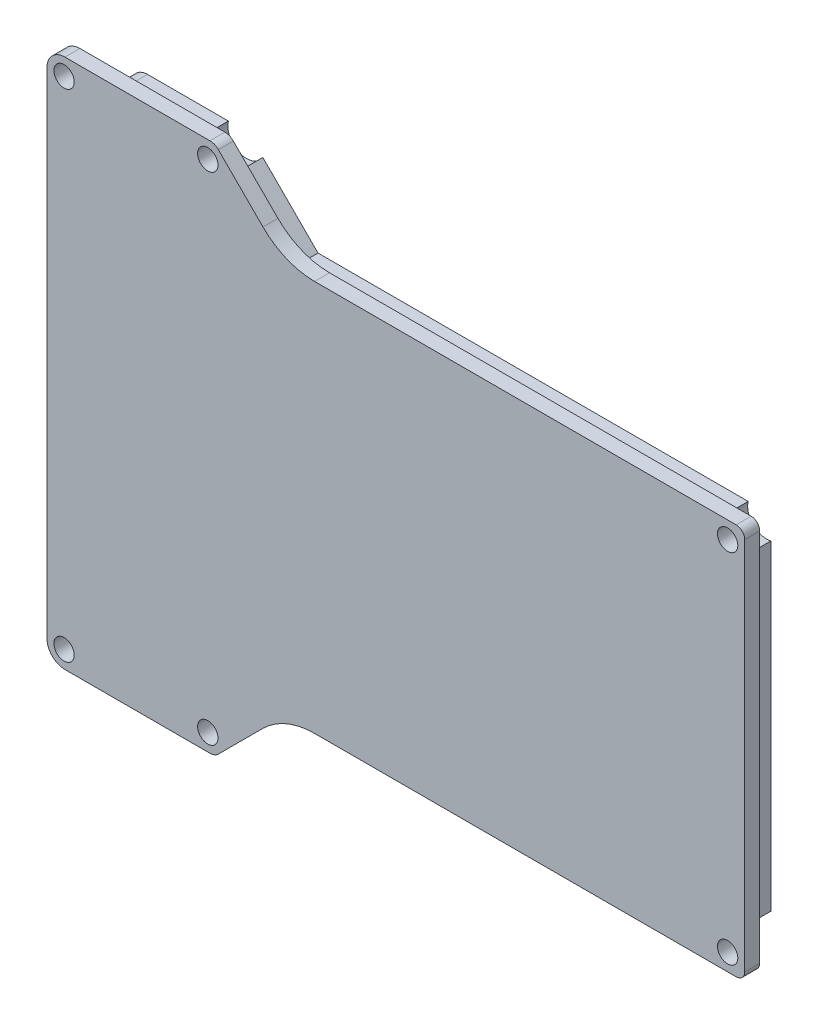
from build123d import *

# Parameters (mm, degrees)
BOSS_EXTRUDE1_DEPTH = 2.5
BOSS_EXTRUDE2_DEPTH = 4
SKETCH2_R           = 1.7
CUT_EXTRUDE1_DEPTH  = 10


with BuildPart() as part:
    # Sketch1 → Boss-Extrude1 (new body)
    with BuildSketch(Plane.XY):
        with BuildLine():
            Line((-4.3, -102.073599188), (19.918814142, -102.073599188))
            ThreePointArc((19.918814142, -102.073599188), (20.684181007, -101.921358253), (21.333027704, -101.48781275))
            Line((21.333027704, -101.48781275), (28.78511557, -94.035724885))
            ThreePointArc((28.78511557, -94.035724885), (32.741782732, -91.39196441), (37.408989873, -90.463599188))
            Line((37.408989873, -90.463599188), (107.834, -90.463599188))
            ThreePointArc((107.834, -90.463599188), (108.841627163, -90.046226351), (109.259, -89.038599188))
            Line((109.259, -89.038599188), (109.259, -26.495599188))
            ThreePointArc((109.259, -26.495599188), (108.841627163, -25.487972025), (107.834, -25.070599188))
            Line((107.834, -25.070599188), (37.403989873, -25.070599188))
            ThreePointArc((37.403989873, -25.070599188), (32.736782732, -24.142233967), (28.78011557, -21.498473491))
            Line((28.78011557, -21.498473491), (21.333027704, -14.051385626))
            ThreePointArc((21.333027704, -14.051385626), (20.684181007, -13.617840123), (19.918814142, -13.465599188))
            Line((19.918814142, -13.465599188), (-4.3, -13.465599188))
            ThreePointArc((-4.3, -13.465599188), (-6.421320344, -14.344278845), (-7.3, -16.465599188))
            Line((-7.3, -16.465599188), (-7.3, -99.073599188))
            ThreePointArc((-7.3, -99.073599188), (-6.421320344, -101.194919532), (-4.3, -102.073599188))
        make_face()
    extrude(amount=BOSS_EXTRUDE1_DEPTH)

    # Sketch1<3> → Boss-Extrude2 (add)
    with BuildSketch(Plane.XY):
        with BuildLine():
            ThreePointArc((22.260800834, -17.95466409), (18.358889111, -19.231591354), (16.502744799, -15.569599188))
            Line((16.502744799, -15.569599188), (3, -15.569599188))
            ThreePointArc((3, -15.569599188), (1.090811691, -16.360410879), (0.3, -18.269599188))
            Line((0.3, -18.269599188), (0.3, -97.269599188))
            ThreePointArc((0.3, -97.269599188), (1.090811691, -99.178787497), (3, -99.969599188))
            Line((3, -99.969599188), (16.502744799, -99.969599188))
            ThreePointArc((16.502744799, -99.969599188), (18.358889111, -96.307607022), (22.260800834, -97.584534286))
            Line((22.260800834, -97.584534286), (31.485735931, -88.359599188))
            Line((31.485735931, -88.359599188), (103.343254826, -88.359599188))
            ThreePointArc((103.343254826, -88.359599188), (104.176492319, -85.381091507), (107.155, -84.547854014))
            Line((107.155, -84.547854014), (107.155, -30.986344362))
            ThreePointArc((107.155, -30.986344362), (104.176492319, -30.153106869), (103.343254826, -27.174599188))
            Line((103.343254826, -27.174599188), (31.480735931, -27.174599188))
            Line((31.480735931, -27.174599188), (22.260800834, -17.95466409))
        make_face()
        with BuildLine():
            Line((22, -71.479599188), (90.115, -71.479599188))
            Line((90.115, -71.479599188), (105.155, -71.479599188))
            Line((105.155, -71.479599188), (105.155, -82.611758523))
            ThreePointArc((105.155, -82.611758523), (102.762278757, -83.966877945), (101.407159334, -86.359599188))
            Line((101.407159334, -86.359599188), (30.657308807, -86.359599188))
            Line((30.657308807, -86.359599188), (22.215613523, -94.801294472))
            ThreePointArc((22.215613523, -94.801294472), (17.593522246, -94.459847957), (14.566649307, -97.969599188))
            Line((14.566649307, -97.969599188), (3, -97.969599188))
            ThreePointArc((3, -97.969599188), (2.505025253, -97.764573935), (2.3, -97.269599188))
            Line((2.3, -97.269599188), (2.3, -71.479599188))
            Line((2.3, -71.479599188), (22, -71.479599188))
        make_face(mode=Mode.SUBTRACT)
        Polygon((2.3, -44.374599188), (22, -44.374599188), (90.115, -44.374599188), (105.155, -44.374599188), (105.155, -69.479599188), (90.115, -69.479599188), (22, -69.479599188), (2.3, -69.479599188), align=None, mode=Mode.SUBTRACT)
        with BuildLine():
            Line((105.155, -42.374599188), (90.115, -42.374599188))
            Line((90.115, -42.374599188), (22, -42.374599188))
            Line((22, -42.374599188), (2.3, -42.374599188))
            Line((2.3, -42.374599188), (2.3, -18.269599188))
            ThreePointArc((2.3, -18.269599188), (2.505025253, -17.774624441), (3, -17.569599188))
            Line((3, -17.569599188), (14.566649307, -17.569599188))
            ThreePointArc((14.566649307, -17.569599188), (17.593522246, -21.079350419), (22.215613523, -20.737903904))
            Line((22.215613523, -20.737903904), (30.652308807, -29.174599188))
            Line((30.652308807, -29.174599188), (101.407159334, -29.174599188))
            ThreePointArc((101.407159334, -29.174599188), (102.762278757, -31.567320432), (105.155, -32.922439854))
            Line((105.155, -32.922439854), (105.155, -42.374599188))
        make_face(mode=Mode.SUBTRACT)
    extrude(amount=-BOSS_EXTRUDE2_DEPTH)

    # Sketch2 → Cut-Extrude1 (cut)
    with BuildSketch(Plane.XY.offset(2.5)):
        with Locations((106.406, -87.610599188)):
            Circle(SKETCH2_R)
        with Locations((106.406, -27.923599188)):
            Circle(SKETCH2_R)
        with Locations((-4.447, -16.318599188)):
            Circle(SKETCH2_R)
        with Locations((19.565489973, -16.318599188)):
            Circle(SKETCH2_R)
        with Locations((19.565489973, -99.220599188)):
            Circle(SKETCH2_R)
        with Locations((-4.447, -99.220599188)):
            Circle(SKETCH2_R)
    extrude(amount=-CUT_EXTRUDE1_DEPTH, mode=Mode.SUBTRACT)


solid = part.part
